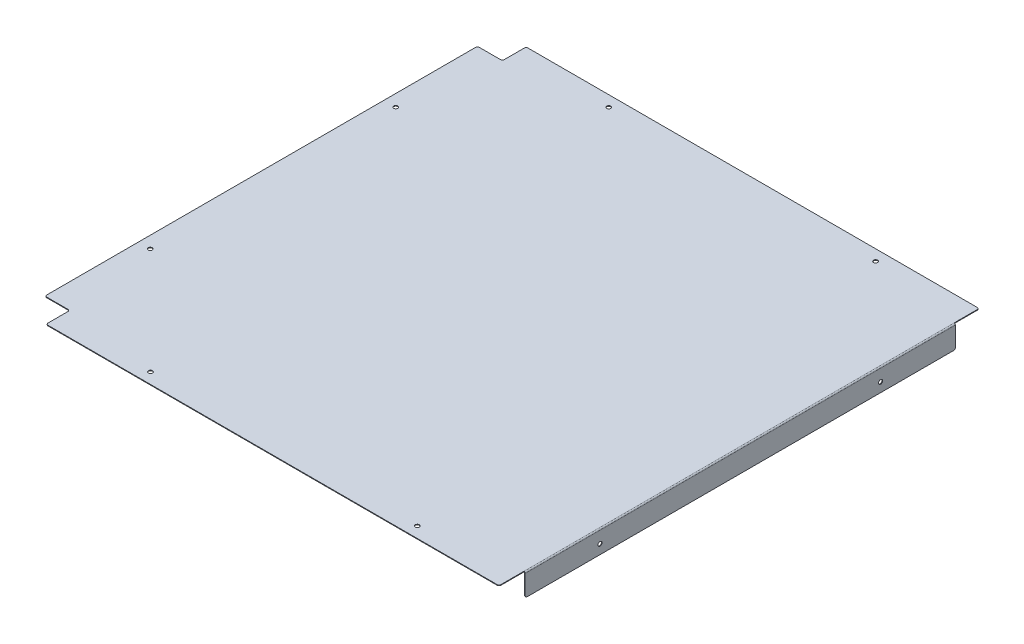
from build123d import *

# Parameters (mm, degrees)
BOSS_EXTRUDE1_DEPTH  = 1
M6_CLEARANCE_HOLE1_D = 6.6
SKETCH8_W            = 41.5
SKETCH8_H            = 838.415827604
CUT_EXTRUDE1_DEPTH   = 10
EDGE_FLANGE1_DEPTH   = 690.012501954
FILLET1_R            = 3
M6_CLEARANCE_HOLE2_D = 6.6


# Sheet-metal steps are written as plain solids
with BuildPart() as part:
    # Sketch1 → Boss-Extrude1 (new body)
    with BuildSketch(Plane(origin=(0, 0, 0), x_dir=(1, 0, 0), z_dir=(0, 1, 0))):
        Polygon((-364, -346.881188119), (-364, -385), (364, -385), (364, -346.881188119), (404, -346.881188119), (404, 346.881188119), (364, 346.881188119), (364, 385), (-364, 385), (-364, 346.881188119), (-404, 346.881188119), (-404, -346.881188119), align=None)
    extrude(amount=BOSS_EXTRUDE1_DEPTH)

    # M6 Clearance Hole1 (through all)
    with Locations(Plane(origin=(0, 1, 0), x_dir=(1, 0, 0), z_dir=(0, 1, 0))):
        with Locations((-214, -367.5), (-385, -196.881188119), (-385, 196.881188119), (-214, 367.5), (214, 367.5), (214, -367.5), (385, -286.881188119), (385, -86.881188119)):
            Hole(M6_CLEARANCE_HOLE1_D / 2)

    # Sketch8 → Cut-Extrude1 (cut)
    with BuildSketch(Plane(origin=(0, 1, 0), x_dir=(1, 0, 0), z_dir=(0, 1, 0))):
        with Locations((383.25, -15.625663738)):
            Rectangle(SKETCH8_W, SKETCH8_H)
    extrude(amount=-CUT_EXTRUDE1_DEPTH, mode=Mode.SUBTRACT)

    # Edge-Flange1 section (across the edge) → Edge-Flange1 (add)
    with BuildSketch(Plane(origin=(363.5, 0, -345), x_dir=(-1, 0, 0), z_dir=(0, 0, 1))):
        with BuildLine():
            Line((-1, 1), (-1, 35))
            Line((-1, 35), (0, 35))
            Line((0, 35), (0, 1))
            ThreePointArc((0, 1), (0.292893219, 0.292893219), (1, 0))
            Line((1, 0), (1, -1))
            ThreePointArc((1, -1), (-0.414213562, -0.414213562), (-1, 1))
        make_face()
    extrude(amount=EDGE_FLANGE1_DEPTH)

    # Fillet1
    fillet1_edges = [part.edges().sort_by_distance(p)[0] for p in [
        (364, -35, -345),
        (364, -35, 345.012501954),
        (-364, 0.5, 385),
        (-364, 0.5, 346.881188119),
        (-404, 0.5, 346.881188119),
        (-404, 0.5, -346.881188119),
        (-364, 0.5, -346.881188119),
        (-364, 0.5, -385),
        (362.5, 0.5, -385),
        (362.5, 0.5, 385),
    ]]
    fillet(fillet1_edges, radius=FILLET1_R)

    # M6 Clearance Hole2 (through all)
    with Locations(Plane(origin=(364.5, 0, 0), x_dir=(0, 0, -1), z_dir=(1, 0, 0))):
        with Locations((-225, -20), (225, -20)):
            Hole(M6_CLEARANCE_HOLE2_D / 2)


solid = part.part
